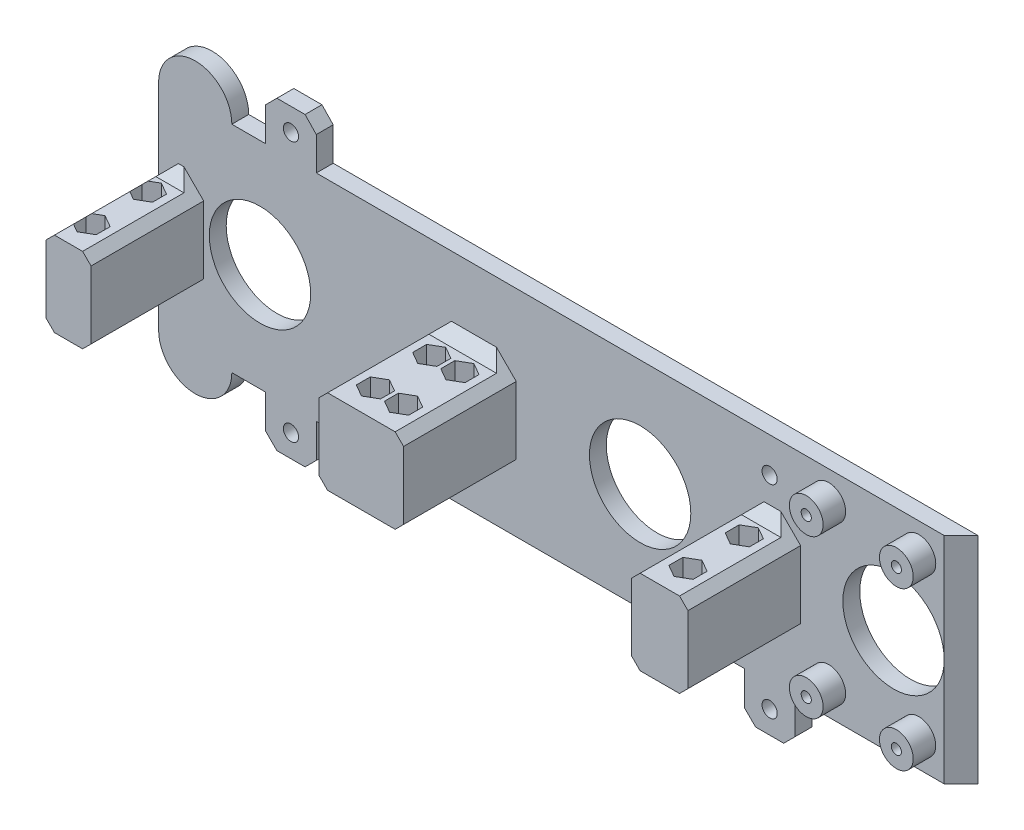
from build123d import *

# Parameters (mm, degrees)
SKETCH1_R           = 1.35
BOSS_EXTRUDE1_DEPTH = 3
CHAMFER1_SIZE       = 3
SKETCH3_W           = 10
SKETCH3_H           = 15
SKETCH3_W_2         = 15
SKETCH3_W_3         = 8
BOSS_EXTRUDE2_DEPTH = 20
SKETCH4_R           = 1.25
CUT_EXTRUDE1_DEPTH  = 15
CHAMFER2_SIZE       = 1.5
CUT_EXTRUDE2_DEPTH  = 8
SKETCH2_R           = 9
CUT_EXTRUDE3_DEPTH  = 3
SKETCH6_R           = 3
BOSS_EXTRUDE3_DEPTH = 4
SKETCH7_R           = 0.9
CUT_EXTRUDE4_DEPTH  = 7
CHAMFER3_SIZE       = 2


with BuildPart() as part:
    # Sketch1 → Boss-Extrude1 (new body)
    with BuildSketch(Plane.XY):
        with BuildLine():
            Line((19, 44.2), (19, 38.2))
            Line((19, 38.2), (13, 38.2))
            ThreePointArc((13, 38.2), (6.5, 44.7), (0, 38.2))
            Line((0, 38.2), (0, 0))
            ThreePointArc((0, 0), (6.5, -6.5), (13, 0))
            Line((13, 0), (19, 0))
            Line((19, 0), (19, -6))
            Line((19, -6), (21, -8))
            Line((21, -8), (26, -8))
            Line((26, -8), (28, -6))
            Line((28, -6), (28, 0))
            Line((28, 0), (104, 0))
            Line((104, 0), (104, -6))
            Line((104, -6), (106, -8))
            Line((106, -8), (111, -8))
            Line((111, -8), (113, -6))
            Line((113, -6), (113, 0))
            Line((113, 0), (142.5, 0))
            Line((142.5, 0), (142.5, 38.2))
            Line((142.5, 38.2), (28, 38.2))
            Line((28, 38.2), (28, 44.114771772))
            Line((28, 44.114771772), (26, 46.2))
            Line((26, 46.2), (21, 46.2))
            Line((21, 46.2), (19, 44.2))
        make_face()
        with Locations((23.5, 42.2)):
            Circle(SKETCH1_R, mode=Mode.SUBTRACT)
        with Locations((108.5, 32)):
            Circle(SKETCH1_R, mode=Mode.SUBTRACT)
        with Locations((108.5, -4)):
            Circle(SKETCH1_R, mode=Mode.SUBTRACT)
        with Locations((23.5, -4)):
            Circle(SKETCH1_R, mode=Mode.SUBTRACT)
    extrude(amount=BOSS_EXTRUDE1_DEPTH)

    # Chamfer1
    chamfer1_edges = [part.edges().sort_by_distance(p)[0] for p in [
        (142.5, 19.1, 3),
    ]]
    chamfer(chamfer1_edges, length=CHAMFER1_SIZE - 0.0001)  # a hair under: the kernel refuses the full size

    # Sketch3 → Boss-Extrude2 (add)
    with BuildSketch(Plane.XY.offset(3)):
        with Locations((109, 17.9)):
            Rectangle(SKETCH3_W, SKETCH3_H)
        with Locations((56, 17.9)):
            Rectangle(SKETCH3_W_2, SKETCH3_H)
        with Locations((4, 17.9)):
            Rectangle(SKETCH3_W_3, SKETCH3_H)
    extrude(amount=BOSS_EXTRUDE2_DEPTH)

    # Sketch4 → Cut-Extrude1 (cut)
    with BuildSketch(Plane(origin=(0, 25.4, 0), x_dir=(1, 0, 0), z_dir=(0, 1, 0))):
        with Locations(Location((58.5, -18, 0), (0, 0, 180))):
            Circle(SKETCH4_R)
        with Locations(Location((53.5, -18, 0), (0, 0, 180))):
            Circle(SKETCH4_R)
        with Locations(Location((53.5, -8, 0), (0, 0, 180))):
            Circle(SKETCH4_R)
        with Locations(Location((58.5, -8, 0), (0, 0, 180))):
            Circle(SKETCH4_R)
        with Locations(Location((109, -18, 0), (0, 0, 180))):
            Circle(SKETCH4_R)
        with Locations(Location((3, -18, 0), (0, 0, 180))):
            Circle(SKETCH4_R)
        with Locations(Location((3, -8, 0), (0, 0, 180))):
            Circle(SKETCH4_R)
        with Locations(Location((109, -8, 0), (0, 0, 180))):
            Circle(SKETCH4_R)
    extrude(amount=-CUT_EXTRUDE1_DEPTH, mode=Mode.SUBTRACT)

    # Chamfer2
    chamfer2_edges = [part.edges().sort_by_distance(p)[0] for p in [
        (114, 10.4, 13),
        (114, 25.4, 13),
        (104, 25.4, 13),
        (104, 10.4, 13),
        (63.5, 10.4, 13),
        (63.5, 25.4, 13),
        (48.5, 25.4, 13),
        (48.5, 10.4, 13),
        (8, 10.4, 13),
        (8, 25.4, 13),
        (0, 25.4, 13),
        (0, 10.4, 13),
    ]]
    chamfer(chamfer2_edges, length=CHAMFER2_SIZE)

    # Sketch5 → Cut-Extrude2 (cut)
    with BuildSketch(Plane(origin=(0, 25.4, 0), x_dir=(1, 0, 0), z_dir=(0, 1, 0))):
        Polygon((3, -5.517393842), (0.85, -6.758696921), (0.85, -9.241303079), (3, -10.482606158), (5.15, -9.241303079), (5.15, -6.758696921), align=None)
        Polygon((3, -15.517393842), (0.85, -16.758696921), (0.85, -19.241303079), (3, -20.482606158), (5.15, -19.241303079), (5.15, -16.758696921), align=None)
        Polygon((53.5, -5.517393842), (51.35, -6.758696921), (51.35, -9.241303079), (53.5, -10.482606158), (55.65, -9.241303079), (55.65, -6.758696921), align=None)
        Polygon((58.5, -5.517393842), (56.35, -6.758696921), (56.35, -9.241303079), (58.5, -10.482606158), (60.65, -9.241303079), (60.65, -6.758696921), align=None)
        Polygon((58.5, -15.517393842), (56.35, -16.758696921), (56.35, -19.241303079), (58.5, -20.482606158), (60.65, -19.241303079), (60.65, -16.758696921), align=None)
        Polygon((53.5, -15.517393842), (51.35, -16.758696921), (51.35, -19.241303079), (53.5, -20.482606158), (55.65, -19.241303079), (55.65, -16.758696921), align=None)
        Polygon((109, -15.517393842), (106.85, -16.758696921), (106.85, -19.241303079), (109, -20.482606158), (111.15, -19.241303079), (111.15, -16.758696921), align=None)
        Polygon((109, -5.517393842), (106.85, -6.758696921), (106.85, -9.241303079), (109, -10.482606158), (111.15, -9.241303079), (111.15, -6.758696921), align=None)
    extrude(amount=-CUT_EXTRUDE2_DEPTH, mode=Mode.SUBTRACT)

    # Sketch2 → Cut-Extrude3 (cut)
    with BuildSketch(Plane(origin=(0, 0, 0), x_dir=(-1, 0, 0), z_dir=(0, 0, -1))):
        with Locations((-18, 19.1)):
            Circle(SKETCH2_R)
        with Locations((-85.5, 19.1)):
            Circle(SKETCH2_R)
        with Locations((-130.5, 19.1)):
            Circle(SKETCH2_R)
    extrude(amount=-CUT_EXTRUDE3_DEPTH, mode=Mode.SUBTRACT)

    # Sketch6 → Boss-Extrude3 (add)
    with BuildSketch(Plane.XY.offset(3)):
        with Locations((119, 33.1)):
            Circle(SKETCH6_R)
        with Locations((135, 33.1)):
            Circle(SKETCH6_R)
        with Locations(Location((135, 5.1, 0), (0, 0, 180))):
            Circle(SKETCH6_R)
        with Locations(Location((119, 5.1, 0), (0, 0, 180))):
            Circle(SKETCH6_R)
    extrude(amount=BOSS_EXTRUDE3_DEPTH)

    # Sketch7 → Cut-Extrude4 (cut)
    with BuildSketch(Plane.XY.offset(7)):
        with Locations((135, 33.1)):
            Circle(SKETCH7_R)
        with Locations((119, 33.1)):
            Circle(SKETCH7_R)
        with Locations((119, 5.1)):
            Circle(SKETCH7_R)
        with Locations((135, 5.1)):
            Circle(SKETCH7_R)
    extrude(amount=-CUT_EXTRUDE4_DEPTH, mode=Mode.SUBTRACT)

    # Chamfer3
    chamfer3_edges = [part.edges().sort_by_distance(p)[0] for p in [
        (56, 25.4, 3),
        (4, 25.4, 3),
        (109, 25.4, 3),
    ]]
    chamfer(chamfer3_edges, length=CHAMFER3_SIZE)


solid = part.part
